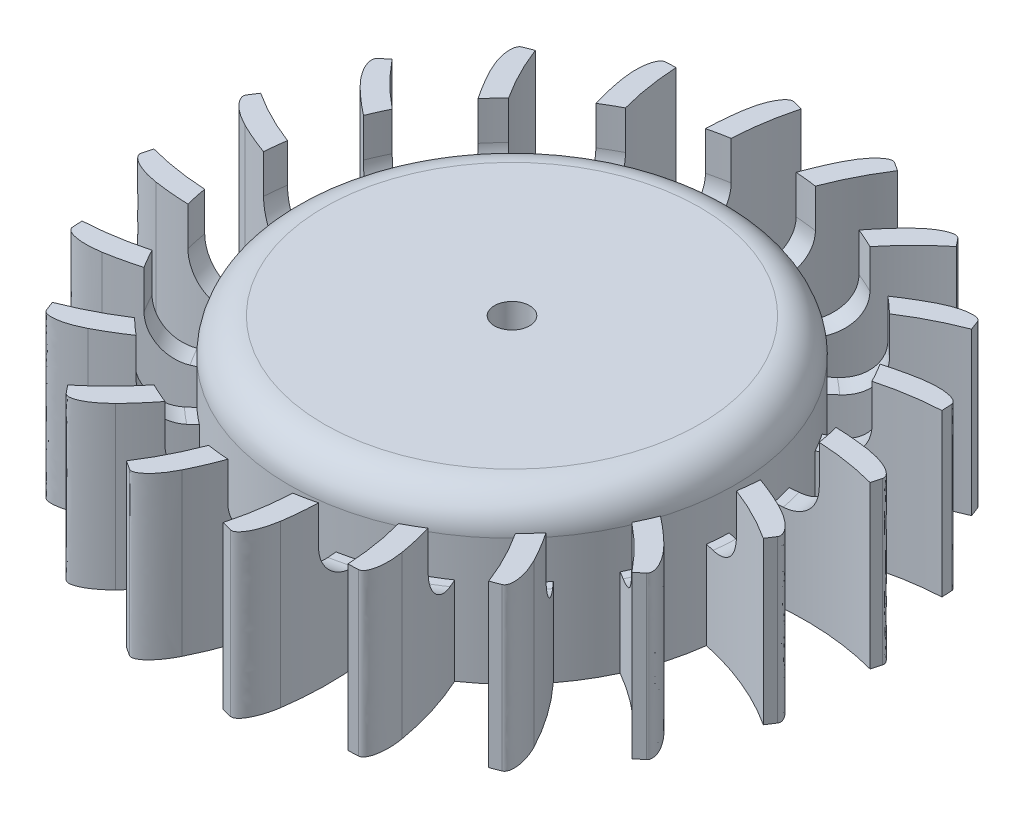
from build123d import *

# Parameters (mm, degrees)
SKETCH1_R           = 12.7
SKETCH1_R_2         = 11.5
EXTRUDE_THIN1_DEPTH = 8
SKETCH2_R           = 12.7
BOSS_EXTRUDE1_DEPTH = 1.2
SKETCH3_R           = 1
CUT_EXTRUDE1_DEPTH  = 21.179692763
EXTRUDE_THIN2_DEPTH = 9.2
CIRPATTERN1_DEPTH   = 9.2
SKETCH5_R           = 2
SKETCH5_R_2         = 1
BOSS_EXTRUDE2_DEPTH = 1.2
FILLET2_R           = 0.5
FILLET3_R           = 2


# Read off the part's stored shape, not the designer's step: CirPattern1
with BuildPart() as part:
    # Sketch1 → Extrude-Thin1 (new body)
    with BuildSketch(Plane(origin=(0, 0, 0), x_dir=(1, 0, 0), z_dir=(0, 1, 0))):
        Circle(SKETCH1_R)
        Circle(SKETCH1_R_2, mode=Mode.SUBTRACT)
    extrude(amount=EXTRUDE_THIN1_DEPTH)

    # Sketch2 → Boss-Extrude1 (add)
    with BuildSketch(Plane(origin=(0, 8, 0), x_dir=(1, 0, 0), z_dir=(0, 1, 0))):
        Circle(SKETCH2_R)
    extrude(amount=BOSS_EXTRUDE1_DEPTH)

    # Sketch3 → Cut-Extrude1 (cut, through all)
    with BuildSketch(Plane(origin=(0, 9.2, 0), x_dir=(1, 0, 0), z_dir=(0, 1, 0))):
        with Locations(Location((0, 0, 0), (0, 0, 270))):
            Circle(SKETCH3_R)
    extrude(amount=-CUT_EXTRUDE1_DEPTH, mode=Mode.SUBTRACT)

    # Sketch4 → Extrude-Thin2 (add)
    with BuildSketch(Plane.XZ):
        with BuildLine():
            ThreePointArc((12.695770312, 0.327744071), (15.860952466, 1.28229979), (18.790362354, 2.814654968))
            Line((18.790362354, 2.814654968), (18.136276953, 3.820722703))
            ThreePointArc((18.136276953, 3.820722703), (15.407581973, 2.393360183), (12.459269179, 1.504207931))
            Line((12.459269179, 1.504207931), (12.695770312, 0.327744071))
        make_face()
    extrude(amount=-EXTRUDE_THIN2_DEPTH)

    # Fillet1
    # an asymmetric fillet: 2, 0.5 mm, written as the material it takes off along each edge
    with BuildSketch(Plane(origin=(18.790362354, -5.155883495, 2.814654968), x_dir=(-0.5450711678288177, 0, 0.8383897792803349), z_dir=(0, 1, 0))) as fillet1_piece_1:
        with BuildLine():
            Bezier((0.617960172, 0), (-0.122274515, 0), (0.121426764, -2.058775626), weights=[1, 0.664247223, 1])
            ThreePointArc((0.121426764, -2.058775626), (0.030383045, -1.031176699), (0, 0))
            Line((0, 0), (0.617960172, 0))
        make_face()
    extrude(amount=19.51176699, mode=Mode.SUBTRACT)

    # CirPattern1 outline → CirPattern1 (add)
    with BuildSketch(Plane(origin=(0, 0, 0), x_dir=(1, 0, 0), z_dir=(0, 1, 0))):
        with BuildLine():
            ThreePointArc((16.720635098, 3.546247414), (14.45028041, 3.726948691), (12.175673573, 3.611505649))
            ThreePointArc((12.175673573, 3.611505649), (12.333909355, 3.02732225), (12.464133361, 2.436263442))
            ThreePointArc((12.464133361, 2.436263442), (15.468239631, 2.479291751), (18.429292624, 1.97069457))
            Line((18.429292624, 1.97069457), (18.580225327, 2.532824164))
            add(Edge.make_bspline(
                [(16.720635098, 3.546247414), (18.772180615, 3.247737137), (18.580225327, 2.532824164)],
                knots=[0, 0, 0, 1, 1, 1], degree=2, weights=[1, 0.664247223, 1]))
        make_face()
        with BuildLine():
            ThreePointArc((14.806418249, 8.539642114), (12.591342864, 8.009921059), (10.463737071, 7.197236033))
            ThreePointArc((10.463737071, 7.197236033), (10.794750841, 6.690542151), (11.101248446, 6.168653251))
            ThreePointArc((11.101248446, 6.168653251), (13.945026812, 7.137895495), (16.918320728, 7.569206527))
            Line((16.918320728, 7.569206527), (16.888158661, 8.150464311))
            add(Edge.make_bspline(
                [(14.806418249, 8.539642114), (16.84979873, 8.889704399), (16.888158661, 8.150464311)],
                knots=[0, 0, 0, 1, 1, 1], degree=2, weights=[1, 0.664247223, 1]))
        make_face()
        with BuildLine():
            ThreePointArc((11.44284602, 12.697117144), (9.499876949, 11.508826545), (7.727537079, 10.078450808))
            ThreePointArc((7.727537079, 10.078450808), (8.198926902, 9.69884517), (8.651695986, 9.297212299))
            ThreePointArc((8.651695986, 9.297212299), (11.056777607, 11.097792295), (13.751265722, 12.426791812))
            Line((13.751265722, 12.426791812), (13.542961359, 12.970280224))
            add(Edge.make_bspline(
                [(11.44284602, 12.697117144), (13.278041146, 13.661485456), (13.542961359, 12.970280224)],
                knots=[0, 0, 0, 1, 1, 1], degree=2, weights=[1, 0.664247223, 1]))
        make_face()
        with BuildLine():
            ThreePointArc((6.959168295, 15.611709882), (5.478496888, 13.881167902), (4.234911917, 11.973116597))
            ThreePointArc((4.234911917, 11.973116597), (4.800534874, 11.757757648), (5.355255245, 11.51569543))
            ThreePointArc((5.355255245, 11.51569543), (7.086213973, 13.971359862), (9.238141017, 16.067956132))
            Line((9.238141017, 16.067956132), (8.872084639, 16.520474739))
            add(Edge.make_bspline(
                [(6.959168295, 15.611709882), (8.406536381, 17.095985131), (8.872084639, 16.520474739)],
                knots=[0, 0, 0, 1, 1, 1], degree=2, weights=[1, 0.664247223, 1]))
        make_face()
        with BuildLine():
            ThreePointArc((1.79427869, 16.998119684), (0.920843382, 14.894723829), (0.327744071, 12.695770312))
            ThreePointArc((0.327744071, 12.695770312), (0.932233045, 12.665738886), (1.534604807, 12.606942059))
            ThreePointArc((1.534604807, 12.606942059), (2.422002343, 15.477313382), (3.820722703, 18.136276953))
            Line((3.820722703, 18.136276953), (3.33274646, 18.453530082))
            add(Edge.make_bspline(
                [(1.79427869, 16.998119684), (2.712141264, 18.857010667), (3.33274646, 18.453530082)],
                knots=[0, 0, 0, 1, 1, 1], degree=2, weights=[1, 0.664247223, 1]))
        make_face()
        with BuildLine():
            ThreePointArc((-3.546247414, 16.720635098), (-3.726948691, 14.45028041), (-3.611505649, 12.175673573))
            ThreePointArc((-3.611505649, 12.175673573), (-3.02732225, 12.333909355), (-2.436263442, 12.46413336))
            ThreePointArc((-2.436263442, 12.46413336), (-2.479291751, 15.468239631), (-1.97069457, 18.429292624))
            Line((-1.97069457, 18.429292624), (-2.532824164, 18.580225327))
            add(Edge.make_bspline(
                [(-3.546247414, 16.720635098), (-3.247737137, 18.772180615), (-2.532824164, 18.580225327)],
                knots=[0, 0, 0, 1, 1, 1], degree=2, weights=[1, 0.664247223, 1]))
        make_face()
        with BuildLine():
            ThreePointArc((-8.539642114, 14.806418249), (-8.009921059, 12.591342864), (-7.197236033, 10.463737071))
            ThreePointArc((-7.197236033, 10.463737071), (-6.690542151, 10.794750841), (-6.168653251, 11.101248446))
            ThreePointArc((-6.168653251, 11.101248446), (-7.137895495, 13.945026812), (-7.569206527, 16.918320728))
            Line((-7.569206527, 16.918320728), (-8.150464311, 16.888158661))
            add(Edge.make_bspline(
                [(-8.539642114, 14.806418249), (-8.889704399, 16.84979873), (-8.150464311, 16.888158661)],
                knots=[0, 0, 0, 1, 1, 1], degree=2, weights=[1, 0.664247223, 1]))
        make_face()
        with BuildLine():
            ThreePointArc((-12.697117144, 11.44284602), (-11.508826545, 9.499876949), (-10.078450808, 7.727537079))
            ThreePointArc((-10.078450808, 7.727537079), (-9.69884517, 8.198926903), (-9.2972123, 8.651695987))
            ThreePointArc((-9.2972123, 8.651695987), (-11.097792295, 11.056777607), (-12.426791812, 13.751265722))
            Line((-12.426791812, 13.751265722), (-12.970280224, 13.542961359))
            add(Edge.make_bspline(
                [(-12.697117144, 11.44284602), (-13.661485456, 13.278041146), (-12.970280224, 13.542961359)],
                knots=[0, 0, 0, 1, 1, 1], degree=2, weights=[1, 0.664247223, 1]))
        make_face()
        with BuildLine():
            ThreePointArc((-15.611709882, 6.959168295), (-13.881167902, 5.478496888), (-11.973116597, 4.234911917))
            ThreePointArc((-11.973116597, 4.234911917), (-11.757757648, 4.800534874), (-11.515695431, 5.355255245))
            ThreePointArc((-11.515695431, 5.355255245), (-13.971359862, 7.086213973), (-16.067956132, 9.238141017))
            Line((-16.067956132, 9.238141017), (-16.520474739, 8.872084639))
            add(Edge.make_bspline(
                [(-15.611709882, 6.959168295), (-17.095985131, 8.406536381), (-16.520474739, 8.872084639)],
                knots=[0, 0, 0, 1, 1, 1], degree=2, weights=[1, 0.664247223, 1]))
        make_face()
        with BuildLine():
            ThreePointArc((-16.998119684, 1.79427869), (-14.894723829, 0.920843382), (-12.695770312, 0.327744071))
            ThreePointArc((-12.695770312, 0.327744071), (-12.665738887, 0.932233045), (-12.606942059, 1.534604807))
            ThreePointArc((-12.606942059, 1.534604807), (-15.477313382, 2.422002343), (-18.136276953, 3.820722703))
            Line((-18.136276953, 3.820722703), (-18.453530082, 3.33274646))
            add(Edge.make_bspline(
                [(-16.998119684, 1.79427869), (-18.857010667, 2.712141264), (-18.453530082, 3.33274646)],
                knots=[0, 0, 0, 1, 1, 1], degree=2, weights=[1, 0.664247223, 1]))
        make_face()
        with BuildLine():
            ThreePointArc((-16.720635098, -3.546247414), (-14.45028041, -3.726948691), (-12.175673573, -3.611505649))
            ThreePointArc((-12.175673573, -3.611505649), (-12.333909356, -3.02732225), (-12.464133361, -2.436263442))
            ThreePointArc((-12.464133361, -2.436263442), (-15.468239631, -2.479291751), (-18.429292624, -1.97069457))
            Line((-18.429292624, -1.97069457), (-18.580225327, -2.532824164))
            add(Edge.make_bspline(
                [(-16.720635098, -3.546247414), (-18.772180615, -3.247737137), (-18.580225327, -2.532824164)],
                knots=[0, 0, 0, 1, 1, 1], degree=2, weights=[1, 0.664247223, 1]))
        make_face()
        with BuildLine():
            ThreePointArc((-14.806418249, -8.539642114), (-12.591342864, -8.009921059), (-10.463737071, -7.197236033))
            ThreePointArc((-10.463737071, -7.197236033), (-10.794750842, -6.690542151), (-11.101248447, -6.168653251))
            ThreePointArc((-11.101248447, -6.168653251), (-13.945026812, -7.137895495), (-16.918320728, -7.569206527))
            Line((-16.918320728, -7.569206527), (-16.888158661, -8.150464311))
            add(Edge.make_bspline(
                [(-14.806418249, -8.539642114), (-16.84979873, -8.889704399), (-16.888158661, -8.150464311)],
                knots=[0, 0, 0, 1, 1, 1], degree=2, weights=[1, 0.664247223, 1]))
        make_face()
        with BuildLine():
            ThreePointArc((-11.44284602, -12.697117144), (-9.499876949, -11.508826545), (-7.727537079, -10.078450808))
            ThreePointArc((-7.727537079, -10.078450808), (-8.198926903, -9.698845171), (-8.651695987, -9.2972123))
            ThreePointArc((-8.651695987, -9.2972123), (-11.056777607, -11.097792295), (-13.751265722, -12.426791812))
            Line((-13.751265722, -12.426791812), (-13.542961359, -12.970280224))
            add(Edge.make_bspline(
                [(-11.44284602, -12.697117144), (-13.278041146, -13.661485456), (-13.542961359, -12.970280224)],
                knots=[0, 0, 0, 1, 1, 1], degree=2, weights=[1, 0.664247223, 1]))
        make_face()
        with BuildLine():
            ThreePointArc((-6.959168295, -15.611709882), (-5.478496888, -13.881167902), (-4.234911917, -11.973116597))
            ThreePointArc((-4.234911917, -11.973116597), (-4.800534875, -11.757757649), (-5.355255245, -11.515695432))
            ThreePointArc((-5.355255245, -11.515695432), (-7.086213973, -13.971359862), (-9.238141017, -16.067956132))
            Line((-9.238141017, -16.067956132), (-8.872084639, -16.520474739))
            add(Edge.make_bspline(
                [(-6.959168295, -15.611709882), (-8.406536381, -17.095985131), (-8.872084639, -16.520474739)],
                knots=[0, 0, 0, 1, 1, 1], degree=2, weights=[1, 0.664247223, 1]))
        make_face()
        with BuildLine():
            ThreePointArc((-1.79427869, -16.998119684), (-0.920843382, -14.894723829), (-0.327744071, -12.695770312))
            ThreePointArc((-0.327744071, -12.695770312), (-0.932233045, -12.665738887), (-1.534604807, -12.60694206))
            ThreePointArc((-1.534604807, -12.60694206), (-2.422002343, -15.477313382), (-3.820722703, -18.136276953))
            Line((-3.820722703, -18.136276953), (-3.33274646, -18.453530082))
            add(Edge.make_bspline(
                [(-1.79427869, -16.998119684), (-2.712141264, -18.857010667), (-3.33274646, -18.453530082)],
                knots=[0, 0, 0, 1, 1, 1], degree=2, weights=[1, 0.664247223, 1]))
        make_face()
        with BuildLine():
            ThreePointArc((3.546247414, -16.720635098), (3.726948691, -14.45028041), (3.611505649, -12.175673573))
            ThreePointArc((3.611505649, -12.175673573), (3.02732225, -12.333909356), (2.436263442, -12.464133361))
            ThreePointArc((2.436263442, -12.464133361), (2.479291751, -15.468239631), (1.97069457, -18.429292624))
            Line((1.97069457, -18.429292624), (2.532824164, -18.580225327))
            add(Edge.make_bspline(
                [(3.546247414, -16.720635098), (3.247737137, -18.772180615), (2.532824164, -18.580225327)],
                knots=[0, 0, 0, 1, 1, 1], degree=2, weights=[1, 0.664247223, 1]))
        make_face()
        with BuildLine():
            ThreePointArc((8.539642114, -14.806418249), (8.009921059, -12.591342864), (7.197236033, -10.463737071))
            ThreePointArc((7.197236033, -10.463737071), (6.690542151, -10.794750841), (6.168653251, -11.101248447))
            ThreePointArc((6.168653251, -11.101248447), (7.137895495, -13.945026812), (7.569206527, -16.918320728))
            Line((7.569206527, -16.918320728), (8.150464311, -16.888158661))
            add(Edge.make_bspline(
                [(8.539642114, -14.806418249), (8.889704399, -16.84979873), (8.150464311, -16.888158661)],
                knots=[0, 0, 0, 1, 1, 1], degree=2, weights=[1, 0.664247223, 1]))
        make_face()
        with BuildLine():
            ThreePointArc((12.697117144, -11.44284602), (11.508826545, -9.499876949), (10.078450808, -7.727537079))
            ThreePointArc((10.078450808, -7.727537079), (9.698845171, -8.198926903), (9.2972123, -8.651695987))
            ThreePointArc((9.2972123, -8.651695987), (11.097792295, -11.056777607), (12.426791812, -13.751265722))
            Line((12.426791812, -13.751265722), (12.970280224, -13.542961359))
            add(Edge.make_bspline(
                [(12.697117144, -11.44284602), (13.661485456, -13.278041146), (12.970280224, -13.542961359)],
                knots=[0, 0, 0, 1, 1, 1], degree=2, weights=[1, 0.664247223, 1]))
        make_face()
        with BuildLine():
            add(Edge.make_bspline(
                [(15.611709882, -6.959168295), (17.095985131, -8.406536381), (16.520474739, -8.872084639)],
                knots=[0, 0, 0, 1, 1, 1], degree=2, weights=[1, 0.664247223, 1]))
            ThreePointArc((15.611709882, -6.959168295), (13.881167902, -5.478496888), (11.973116597, -4.234911917))
            ThreePointArc((11.973116597, -4.234911917), (11.757757648, -4.800534874), (11.515695431, -5.355255245))
            ThreePointArc((11.515695431, -5.355255245), (13.971359862, -7.086213973), (16.067956132, -9.238141017))
            Line((16.067956132, -9.238141017), (16.520474739, -8.872084639))
        make_face()
    extrude(amount=CIRPATTERN1_DEPTH)

    # Sketch5 → Boss-Extrude2 (add)
    with BuildSketch(Plane.XZ.offset(-8)):
        with Locations(Location((0, 0, 0), (0, 0, 90))):
            Circle(SKETCH5_R)
        with Locations(Location((0, 0, 0), (0, 0, 90))):
            Circle(SKETCH5_R_2, mode=Mode.SUBTRACT)
    extrude(amount=BOSS_EXTRUDE2_DEPTH)

    # Fillet2
    fillet2_edges = [part.edges().sort_by_distance(p)[0] for p in [
        (0, 8, -2),
    ]]
    fillet(fillet2_edges, radius=FILLET2_R)

    # Sketch7 → Cut-Revolve1 (revolve, cut)
    with BuildSketch(Plane(origin=(0, 0, 0), x_dir=(0, 0, -1), z_dir=(1, 0, 0)), mode=Mode.PRIVATE) as cut_revolve1_sk:
        with BuildLine():
            Line((12.7, 18.033249603), (15.2, 18.033249603))
            Line((15.2, 18.033249603), (15.2, 7))
            ThreePointArc((15.2, 7), (14.614213562, 5.585786438), (13.2, 5))
            Line((13.2, 5), (12.7, 5))
            Line((12.7, 5), (12.7, 18.033249603))
        make_face()
    revolve(cut_revolve1_sk.sketch.rotate(Axis((0, 8, 0), (0, -1, 0)), 1.478774564), axis=Axis((0, 8, 0), (0, -1, 0)), mode=Mode.SUBTRACT)

    # Fillet3
    fillet3_edges = [part.edges().sort_by_distance(p)[0] for p in [
        (1.060602378, 9.2, 12.655636001),
    ]]
    fillet(fillet3_edges, radius=FILLET3_R)


solid = part.part
